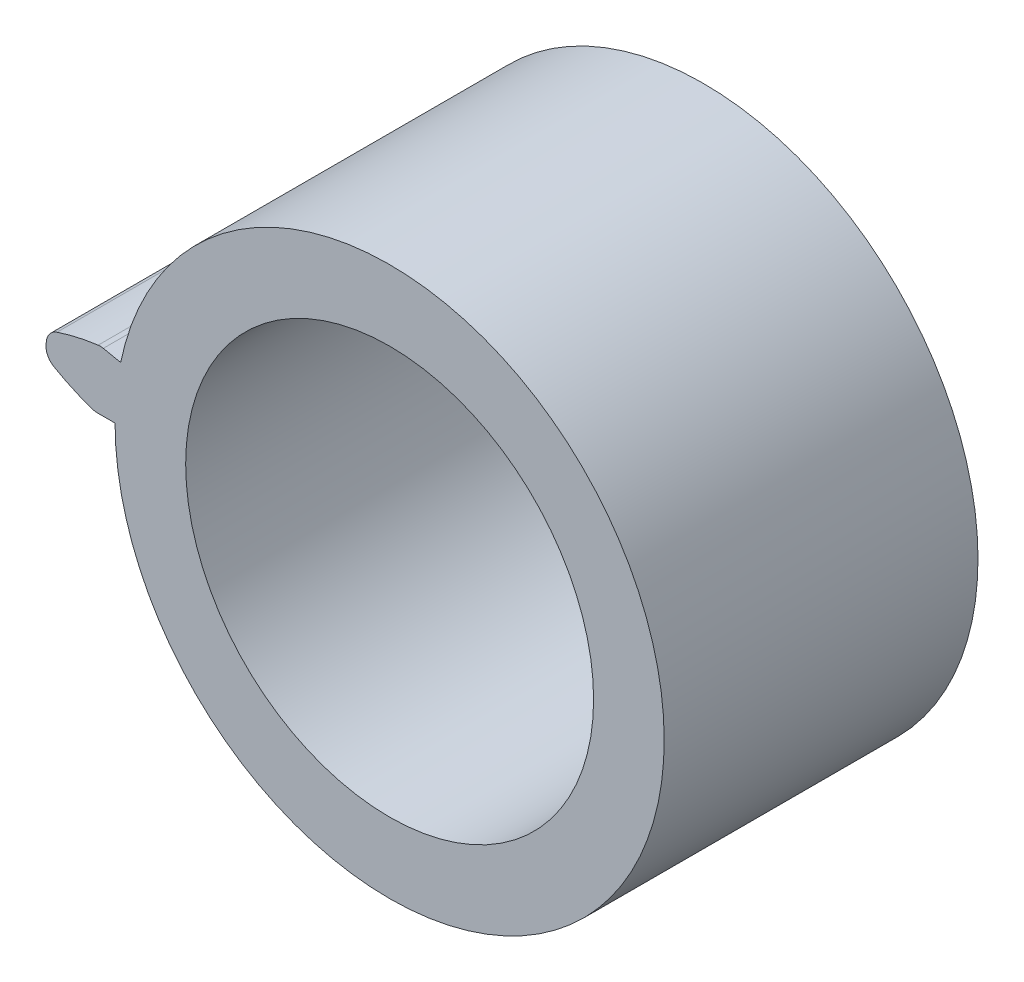
from build123d import *

# Parameters (mm, degrees)
SKETCH1_R           = 6.5
BOSS_EXTRUDE5_DEPTH = 10
BOSS_EXTRUDE6_DEPTH = 10
FILLET3_R           = 0.5


with BuildPart() as part:
    # Sketch1 → Boss-Extrude5 (new body)
    with BuildSketch(Plane(origin=(0, 0, 0), x_dir=(0, 1, 0), z_dir=(0, 0, 1))):
        with BuildLine():
            ThreePointArc((1.761770315, 8.570803075), (0.885430147, 8.705085494), (0, 8.75))
            ThreePointArc((0, 8.75), (-6.187184335, -6.187184335), (8.75, 0))
            ThreePointArc((8.75, 0), (6.781518645, 5.529331322), (1.761770315, 8.570803075))
        make_face()
        Circle(SKETCH1_R, mode=Mode.SUBTRACT)
    extrude(amount=BOSS_EXTRUDE5_DEPTH)

    # Sketch2 → Boss-Extrude6 (add)
    with BuildSketch(Plane(origin=(0, 0, 0), x_dir=(0, 1, 0), z_dir=(0, 0, 1))):
        with BuildLine():
            Line((1.892025788, 9.204480462), (1.761770315, 8.570803075))
            ThreePointArc((1.761770315, 8.570803075), (0.885430147, 8.705085494), (0, 8.75))
            Line((0, 8.75), (0, 9.396926208))
            ThreePointArc((0, 9.396926208), (0.324589742, 10.209430853), (0.749151549, 10.974459985))
            ThreePointArc((0.749151549, 10.974459985), (1.113112185, 10.943536049), (1.475845419, 10.900544954))
            ThreePointArc((1.475845419, 10.900544954), (1.737677423, 10.065699878), (1.892025788, 9.204480462))
        make_face()
    extrude(amount=BOSS_EXTRUDE6_DEPTH)

    # Fillet3
    fillet3_edges = [part.edges().sort_by_distance(p)[0] for p in [
        (-10.900544954, 1.475845419, 5),
        (-10.974459985, 0.749151549, 5),
        (-9.396926208, 0, 5),
        (-9.204480462, 1.892025788, 5),
    ]]
    fillet(fillet3_edges, radius=FILLET3_R)


solid = part.part
